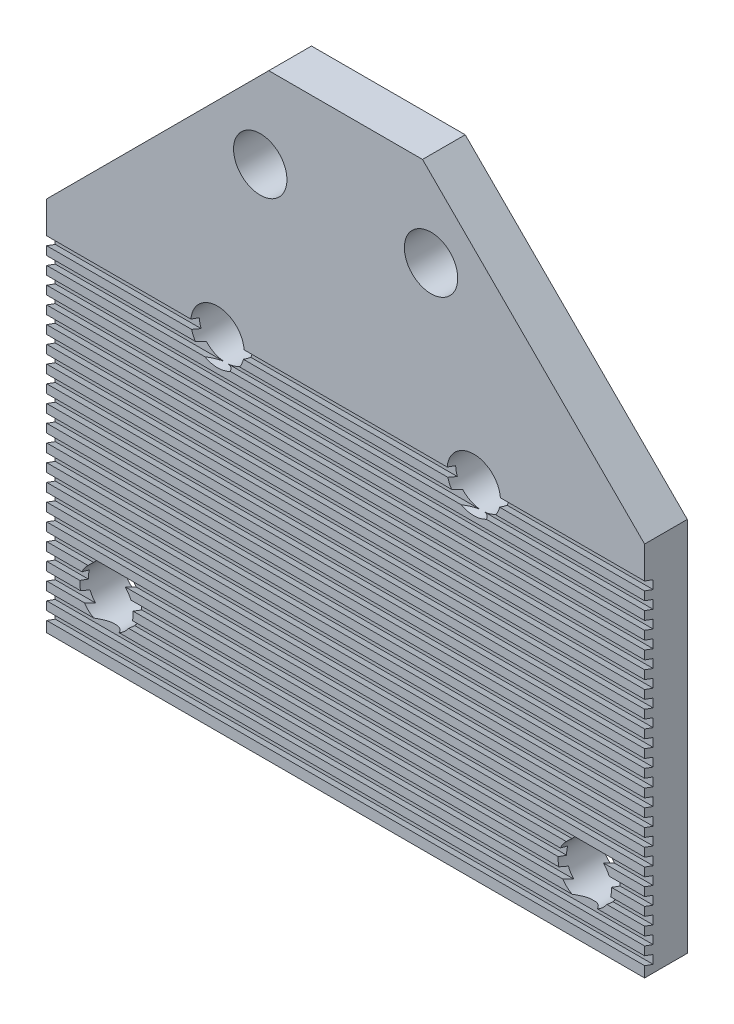
from build123d import *

# Parameters (mm, degrees)
SKETCH1_W                   = 88.9
SKETCH1_H                   = 88.9
BOSS_EXTRUDE1_DEPTH         = 3.175
TAP_DRILL_FOR_3_8_16_TAP2_D = 7.9375
CHAMFER1_SIZE               = 33.02
CUT_EXTRUDE6_DEPTH          = 63.941922635
LPATTERN2_COUNT             = 20
LPATTERN2_PITCH             = 2.54


with BuildPart() as part:
    # Sketch1 → Boss-Extrude1 (new, symmetric)
    with BuildSketch(Plane.XY):
        Rectangle(SKETCH1_W, SKETCH1_H)
    extrude(amount=BOSS_EXTRUDE1_DEPTH, both=True)

    # Tap Drill for 3/8-16 Tap2 (through all)
    with Locations(Plane.XY.offset(3.175)):
        with Locations((-12.7, 31.75), (12.7, 31.75), (19.05, 6.35), (-19.05, 6.35), (-35.56, -35.56), (35.56, -35.56)):
            Hole(TAP_DRILL_FOR_3_8_16_TAP2_D / 2)

    # Chamfer1
    chamfer1_edges = [part.edges().sort_by_distance(p)[0] for p in [
        (44.45, 44.45, 0),
        (-44.45, 44.45, 0),
    ]]
    chamfer(chamfer1_edges, length=CHAMFER1_SIZE)

    # Sketch9 → Cut-Extrude6 (cut, symmetric)
    with BuildSketch(Plane.ZY):
        Polygon((3.175, -42.8625), (1.905, -43.324742198), (1.905, -42.054742198), (3.175, -41.5925), align=None)
    cut_extrude6 = extrude(amount=CUT_EXTRUDE6_DEPTH, both=True, mode=Mode.SUBTRACT)

    # LPattern2: Cut-Extrude6 ×20
    with Locations(*[(0, i * LPATTERN2_PITCH, 0) for i in range(1, LPATTERN2_COUNT)]):
        add(cut_extrude6, mode=Mode.SUBTRACT)


solid = part.part
